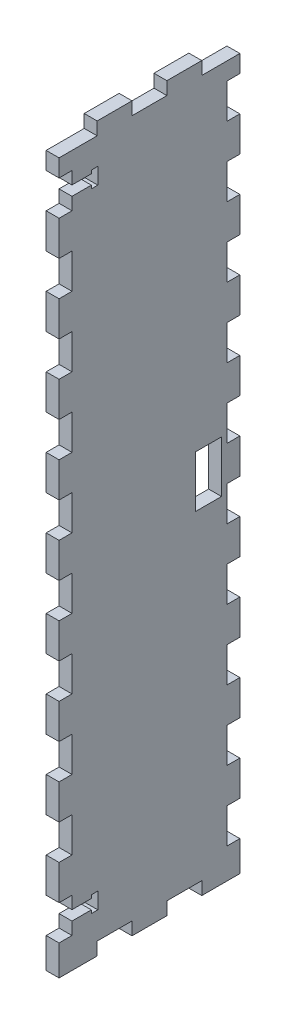
from build123d import *

# Parameters (mm, degrees)
SKETCH1_W           = 12.7
SKETCH1_H           = 25.4
BOSS_EXTRUDE1_DEPTH = 6.35


with BuildPart() as part:
    # Sketch1 → Boss-Extrude1 (new body)
    with BuildSketch(Plane(origin=(0, 0, 0), x_dir=(0, 0, -1), z_dir=(1, 0, 0))):
        Polygon((0, 14.9225), (0, 6.35), (0, 0), (6.35, 0), (18.7325, 0), (18.7325, 6.35), (35.8775, 6.35), (35.8775, 0), (53.0225, 0), (53.0225, 6.35), (70.1675, 6.35), (70.1675, 0), (82.55, 0), (88.9, 0), (88.9, 6.35), (88.9, 14.9225), (82.55, 14.9225), (82.55, 32.0675), (88.9, 32.0675), (88.9, 49.2125), (82.55, 49.2125), (82.55, 66.3575), (88.9, 66.3575), (88.9, 83.5025), (82.55, 83.5025), (82.55, 100.6475), (88.9, 100.6475), (88.9, 117.7925), (82.55, 117.7925), (82.55, 134.9375), (88.9, 134.9375), (88.9, 152.0825), (82.55, 152.0825), (82.55, 169.2275), (88.9, 169.2275), (88.9, 186.3725), (82.55, 186.3725), (82.55, 203.5175), (88.9, 203.5175), (88.9, 220.6625), (82.55, 220.6625), (82.55, 237.8075), (88.9, 237.8075), (88.9, 254.9525), (82.55, 254.9525), (82.55, 272.0975), (88.9, 272.0975), (88.9, 289.2425), (82.55, 289.2425), (82.55, 306.3875), (88.9, 306.3875), (88.9, 323.5325), (82.55, 323.5325), (82.55, 340.6775), (88.9, 340.6775), (88.9, 349.25), (70.1675, 349.25), (70.1675, 355.6), (53.0225, 355.6), (53.0225, 349.25), (35.8775, 349.25), (35.8775, 355.6), (18.7325, 355.6), (18.7325, 349.25), (6.35, 349.25), (0, 349.25), (0, 340.6775), (6.35, 340.6775), (6.35, 334.518000001), (15.875, 334.518000001), (15.875, 336.105000001), (19.05, 336.105000001), (19.05, 328.105000001), (15.875, 328.105000001), (15.875, 329.692000001), (6.35, 329.692000001), (6.35, 323.5325), (0, 323.5325), (0, 306.3875), (6.35, 306.3875), (6.35, 289.2425), (0, 289.2425), (0, 272.0975), (6.35, 272.0975), (6.35, 254.9525), (0, 254.9525), (0, 237.8075), (6.35, 237.8075), (6.35, 220.6625), (0, 220.6625), (0, 203.5175), (6.35, 203.5175), (6.35, 186.3725), (0, 186.3725), (0, 169.2275), (6.35, 169.2275), (6.35, 152.0825), (0, 152.0825), (0, 134.9375), (6.35, 134.9375), (6.35, 117.7925), (0, 117.7925), (0, 100.6475), (6.35, 100.6475), (6.35, 83.5025), (0, 83.5025), (0, 66.3575), (6.35, 66.3575), (6.35, 49.2125), (0, 49.2125), (0, 32.0675), (6.35, 32.0675), (6.35, 25.907999999), (15.875, 25.907999999), (15.875, 27.494999999), (19.05, 27.494999999), (19.05, 19.494999999), (15.875, 19.494999999), (15.875, 21.081999999), (6.35, 21.081999999), (6.35, 14.9225), align=None)
        with Locations((73.528490325, 177.8)):
            Rectangle(SKETCH1_W, SKETCH1_H, mode=Mode.SUBTRACT)
    extrude(amount=BOSS_EXTRUDE1_DEPTH)


solid = part.part
